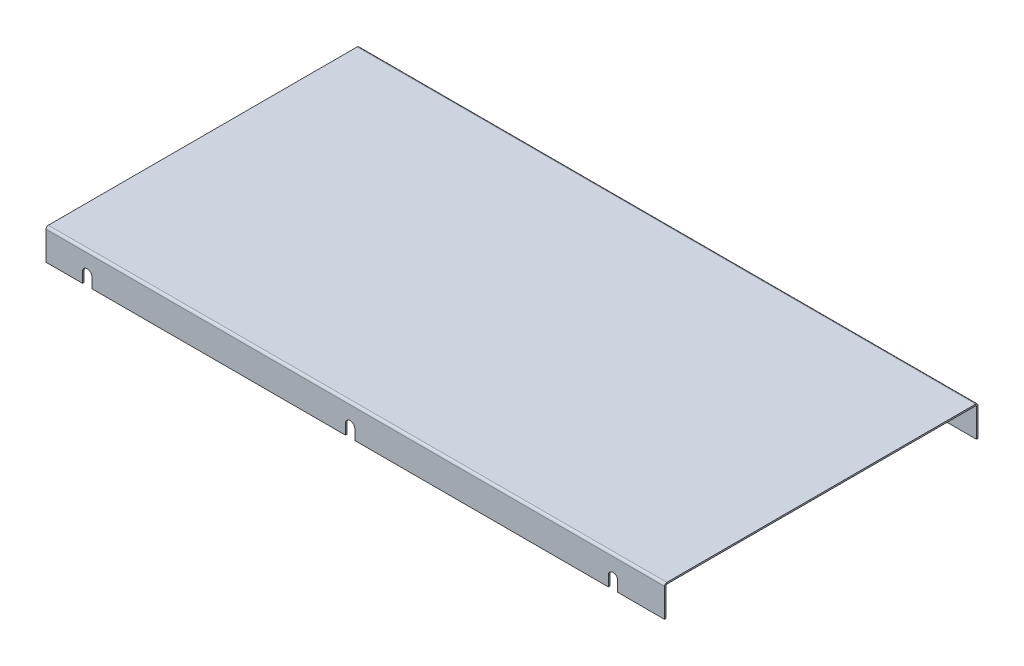
from build123d import *

# Parameters (mm, degrees)
SKETCH_1_W                         = 600
SKETCH_1_H                         = 304
SM_BASE_FLANGE_1_DEPTH             = 1.5
SM_EDGE_FLANGE_1_STRIP_W           = 7.4732
SM_EDGE_FLANGE_1_STRIP_H           = 1.5
SM_EDGE_FLANGE_1_STRIP_CUT_DEPTH   = 600
SM_EDGE_FLANGE_1_STRIP_2_W         = 7.4732
SM_EDGE_FLANGE_1_STRIP_2_H         = 1.5
SM_EDGE_FLANGE_1_STRIP_CUT_2_DEPTH = 600
SM_EDGE_FLANGE_1_DEPTH             = 600
SM_EDGE_FLANGE_1_BEND_DEPTH        = 600
CUT_EXTRUDE_1_DEPTH                = 429.154177838
PATTERN_LINEAR_1_COUNT             = 3
PATTERN_LINEAR_1_PITCH             = 255


# Sheet-metal steps are written as plain solids
with BuildPart() as part:
    # Sketch 1 → 基体-法兰1 (new body)
    with BuildSketch(Plane(origin=(0, 0, 0), x_dir=(1, 0, 0), z_dir=(0, 1, 0))):
        Rectangle(SKETCH_1_W, SKETCH_1_H)
    extrude(amount=-SM_BASE_FLANGE_1_DEPTH)

    # 边线-法兰1 strip (across the edge) → 边线-法兰1 strip cut (cut)
    with BuildSketch(Plane(origin=(300, -1.5, 152), x_dir=(0, 0, -1), z_dir=(-1, 0, 0))):
        with Locations((-1.5, -0.75)):
            Rectangle(SM_EDGE_FLANGE_1_STRIP_W, SM_EDGE_FLANGE_1_STRIP_H)
    extrude(amount=SM_EDGE_FLANGE_1_STRIP_CUT_DEPTH, mode=Mode.SUBTRACT)

    # 边线-法兰1 strip 2 (across the edge) → 边线-法兰1 strip cut 2 (cut)
    with BuildSketch(Plane(origin=(-300, -1.5, -152), x_dir=(0, 0, 1), z_dir=(1, 0, 0))):
        with Locations((-1.5, -0.75)):
            Rectangle(SM_EDGE_FLANGE_1_STRIP_2_W, SM_EDGE_FLANGE_1_STRIP_2_H)
    extrude(amount=SM_EDGE_FLANGE_1_STRIP_CUT_2_DEPTH, mode=Mode.SUBTRACT)

    # 边线-法兰1 section (across the edge) → 边线-法兰1 (add)
    with BuildSketch(Plane(origin=(300, -1.5, 152), x_dir=(0, 0, -1), z_dir=(-1, 0, 0))):
        with BuildLine():
            Line((0, 0.7366), (0, 28.5))
            Line((0, 28.5), (1.5, 28.5))
            Line((1.5, 28.5), (1.5, 0.7366))
            ThreePointArc((1.5, 0.7366), (1.715745145, 0.215745145), (2.2366, 0))
            Line((2.2366, 0), (2.2366, -1.5))
            ThreePointArc((2.2366, -1.5), (0.655084973, -0.844915027), (0, 0.7366))
        make_face()
    extrude(amount=SM_EDGE_FLANGE_1_DEPTH)

    # 边线-法兰1 section 2 (across the edge) → 边线-法兰1 bend (add)
    with BuildSketch(Plane(origin=(-300, -1.5, -152), x_dir=(0, 0, 1), z_dir=(1, 0, 0))):
        with BuildLine():
            Line((0, 0.7366), (0, 28.5))
            Line((0, 28.5), (1.5, 28.5))
            Line((1.5, 28.5), (1.5, 0.7366))
            ThreePointArc((1.5, 0.7366), (1.715745145, 0.215745145), (2.2366, 0))
            Line((2.2366, 0), (2.2366, -1.5))
            ThreePointArc((2.2366, -1.5), (0.655084973, -0.844915027), (0, 0.7366))
        make_face()
    extrude(amount=SM_EDGE_FLANGE_1_BEND_DEPTH)

    # 草图12 → 切除-拉伸1 (cut, through all)
    with BuildSketch(Plane(origin=(0, 0, -152), x_dir=(-1, 0, 0), z_dir=(0, 0, -1))):
        with BuildLine():
            Line((-254.5, -30), (-254.5, -20))
            ThreePointArc((-254.5, -20), (-250, -15.5), (-245.5, -20))
            Line((-245.5, -20), (-245.5, -30))
            ThreePointArc((-245.5, -30), (-250, -34.5), (-254.5, -30))
        make_face()
    cut_extrude_1 = extrude(amount=-CUT_EXTRUDE_1_DEPTH, mode=Mode.SUBTRACT)

    # 阵列(线性)1: 切除-拉伸1 ×3
    with Locations(*[(-i * PATTERN_LINEAR_1_PITCH, 0, 0) for i in range(1, PATTERN_LINEAR_1_COUNT)]):
        add(cut_extrude_1, mode=Mode.SUBTRACT)


solid = part.part
